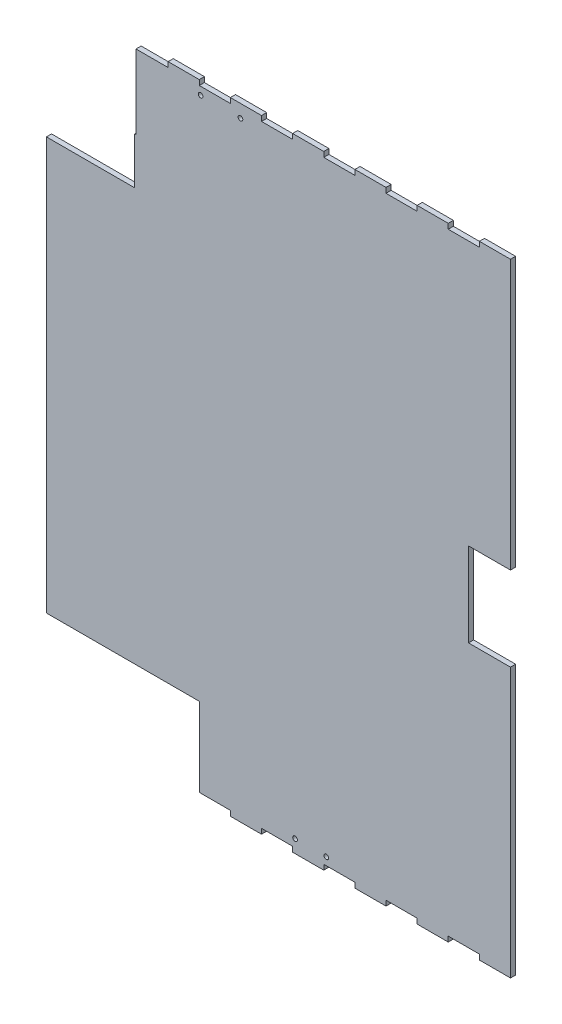
from build123d import *

# Parameters (mm, degrees)
BOSS_EXTRUDE1_DEPTH     = 3.3
SKETCH2_R               = 1.5
CUT_EXTRUDE1_DEPTH      = 453.205952877
CUT_EXTRUDE2_DEPTH      = 455.953272433
CUT_EXTRUDE2_DEPTH_BACK = 455.953272433
SKETCH3_W               = 24.5
SKETCH3_H               = 54
SKETCH4_W               = 26.984189883
SKETCH4_H               = 54
CUT_EXTRUDE3_DEPTH      = 10
SKETCH6_W               = 56.727923661
SKETCH6_H               = 30
CUT_EXTRUDE4_DEPTH      = 10
SKETCH7_W               = 20
SKETCH7_H               = 3.3
BOSS_EXTRUDE2_DEPTH     = 3.3


with BuildPart() as part:
    # Sketch1 → Boss-Extrude1 (new body)
    with BuildSketch(Plane.XY):
        Polygon((25.5, -265), (123.748117859, -265), (123.748117859, -315.7), (323.748117859, -315.7), (323.748117859, 77.7), (83.086263463, 77.7), (83.086263463, 30), (25.5, 30), align=None)
    extrude(amount=BOSS_EXTRUDE1_DEPTH)

    # Sketch2 → Cut-Extrude1 (cut, through all)
    with BuildSketch(Plane(origin=(0, 0, 0), x_dir=(-1, 0, 0), z_dir=(0, 0, -1))):
        with Locations((-150.216261358, 72.7)):
            Circle(SKETCH2_R)
        with Locations((-124.61492379, 72.7)):
            Circle(SKETCH2_R)
        with Locations((-205.394208158, -310.7)):
            Circle(SKETCH2_R)
        with Locations((-185.309760184, -310.7)):
            Circle(SKETCH2_R)
    extrude(amount=-CUT_EXTRUDE1_DEPTH, mode=Mode.SUBTRACT)

    # Sketch3 → Cut-Extrude2 (cut, two sides: drawn at the far end of the back side and taken through both)
    with BuildSketch(Plane(origin=(119.391473557, 0, 256.035841294), x_dir=(0.9063077870366519, 0, -0.42261826174069517), z_dir=(0.42261826174069517, 0, 0.9063077870366519)).offset(-CUT_EXTRUDE2_DEPTH_BACK)):
        with Locations((281.209458836, -119)):
            Rectangle(SKETCH3_W, SKETCH3_H)
    extrude(amount=CUT_EXTRUDE2_DEPTH + CUT_EXTRUDE2_DEPTH_BACK, mode=Mode.SUBTRACT)

    # Sketch4 → Cut-Extrude3 (cut)
    with BuildSketch(Plane(origin=(0, 0, 0), x_dir=(-1, 0, 0), z_dir=(0, 0, -1))):
        with Locations((-310.256022917, -119)):
            Rectangle(SKETCH4_W, SKETCH4_H)
    extrude(amount=-CUT_EXTRUDE3_DEPTH, mode=Mode.SUBTRACT)

    # Sketch6 → Cut-Extrude4 (cut)
    with BuildSketch(Plane.XY.offset(3.3)):
        with Locations((53.863961831, 15)):
            Rectangle(SKETCH6_W, SKETCH6_H)
    extrude(amount=-CUT_EXTRUDE4_DEPTH, mode=Mode.SUBTRACT)

    # Sketch7 → Boss-Extrude2 (add)
    with BuildSketch(Plane(origin=(0, 0, 0), x_dir=(-1, 0, 0), z_dir=(0, 0, -1))):
        with Locations((-193.748117859, -317.35)):
            Rectangle(SKETCH7_W, SKETCH7_H)
        with Locations((-153.748117859, -317.35)):
            Rectangle(SKETCH7_W, SKETCH7_H)
        with Locations((-113.748117859, 79.35)):
            Rectangle(SKETCH7_W, SKETCH7_H)
        with Locations((-153.748117859, 79.35)):
            Rectangle(SKETCH7_W, SKETCH7_H)
        with Locations((-233.748117859, -317.35)):
            Rectangle(SKETCH7_W, SKETCH7_H)
        with Locations((-193.748117859, 79.35)):
            Rectangle(SKETCH7_W, SKETCH7_H)
        with Locations((-273.748117859, -317.35)):
            Rectangle(SKETCH7_W, SKETCH7_H)
        with Locations((-233.748117859, 79.35)):
            Rectangle(SKETCH7_W, SKETCH7_H)
        with Locations((-313.748117859, -317.35)):
            Rectangle(SKETCH7_W, SKETCH7_H)
        with Locations((-273.748117859, 79.35)):
            Rectangle(SKETCH7_W, SKETCH7_H)
        with Locations((-313.748117859, 79.35)):
            Rectangle(SKETCH7_W, SKETCH7_H)
    extrude(amount=-BOSS_EXTRUDE2_DEPTH)


solid = part.part
